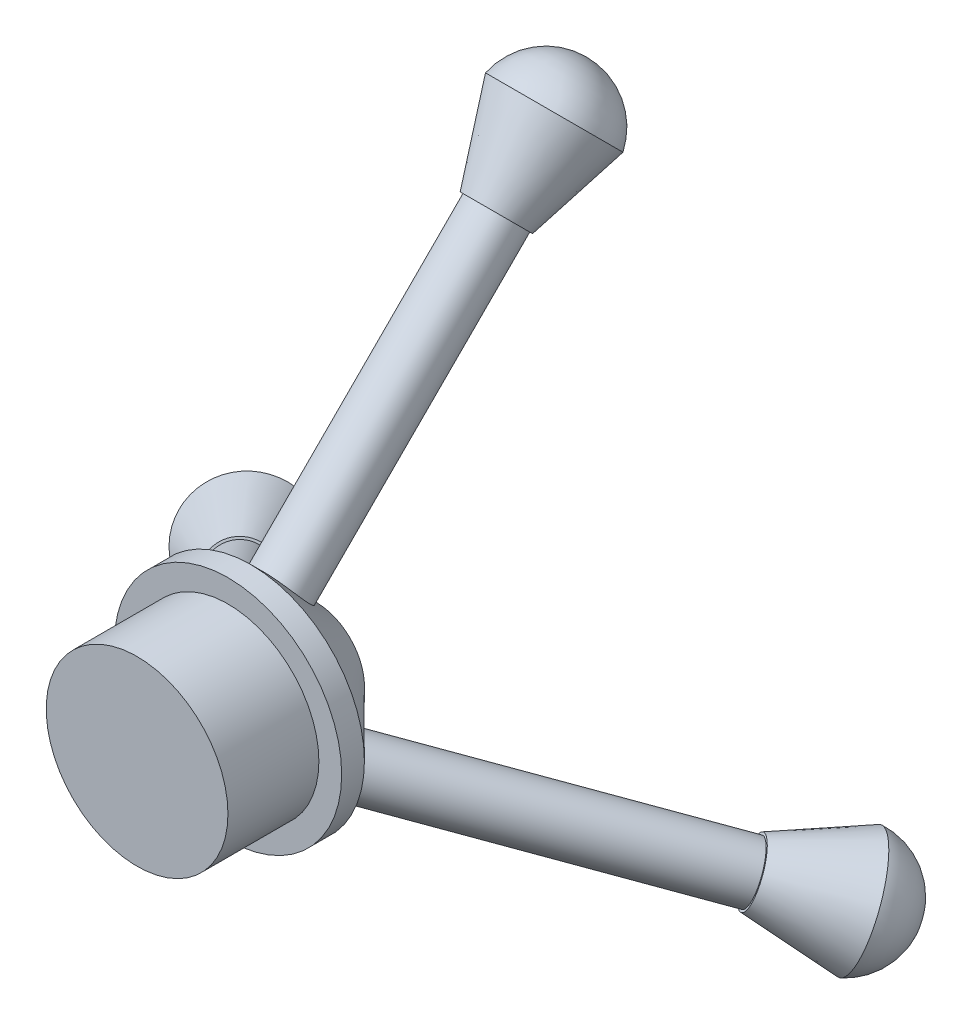
from build123d import *

# Parameters (mm, degrees)
SKETCH1_R                   = 25
BOSS_EXTRUDE1_DEPTH         = 45
CUT_EXTRUDE1_START          = -20
SKETCH2_R                   = 25
SKETCH2_R_2                 = 19.985
CUT_EXTRUDE1_DEPTH          = 20
CHAMFER1_SIZE               = 20
SKETCH3_R                   = 6
BOSS_EXTRUDE2_DEPTH         = 70
CUT_EXTRUDE2_DEPTH          = 70
CUT_EXTRUDE2_DEPTH_BACK     = 70
SKETCH4_W                   = 11.30856595
SKETCH4_H                   = 25.35365412
SKETCH5_R                   = 6.5
BOSS_EXTRUDE3_DEPTH         = 18
BOSS_EXTRUDE3_DRAFT         = -18
CIRPATTERN1_COUNT           = 3
CIRPATTERN1_COPY_1_SKETCH_R = 6.5
CIRPATTERN1_COPY_1_DEPTH    = 18
CIRPATTERN1_COPY_1_DRAFT    = -18
CIRPATTERN1_COPY_2_SKETCH_R = 6.5
CIRPATTERN1_COPY_2_DEPTH    = 18
CIRPATTERN1_COPY_2_DRAFT    = -18


# Read off the part's stored shape, not the designer's step: Dome1
with BuildPart() as part:
    # Sketch1 → Boss-Extrude1 (new body)
    with BuildSketch(Plane.XY):
        with Locations(Location((0, 0, 0), (0, 0, 180))):
            Circle(SKETCH1_R)
    extrude(amount=BOSS_EXTRUDE1_DEPTH)

    # Sketch2 → Cut-Extrude1 (cut)
    with BuildSketch(Plane.XY.offset(45).offset(CUT_EXTRUDE1_START)):
        with Locations(Location((0, 0, 0), (0, 0, 180))):
            Circle(SKETCH2_R)
        Circle(SKETCH2_R_2, mode=Mode.SUBTRACT)
    extrude(amount=CUT_EXTRUDE1_DEPTH, mode=Mode.SUBTRACT)

    # Chamfer1
    chamfer1_edges = [part.edges().sort_by_distance(p)[0] for p in [
        (25, 0, 0),
    ]]
    chamfer(chamfer1_edges, length=CHAMFER1_SIZE)

    # Sketch3 → Boss-Extrude2 (add)
    with BuildSketch(Plane(origin=(0, 0, 0), x_dir=(-1, 0, 0), z_dir=(0, 0.7071067811865475, -0.7071067811865477))):
        with Locations(Location((0, 21.894618235, 0), (0, 0, 291.115116648))):
            Circle(SKETCH3_R)
    boss_extrude2 = extrude(amount=BOSS_EXTRUDE2_DEPTH)

    # Sketch4 → Cut-Extrude2 (cut, two sides: drawn at the far end of the back side and taken through both)
    with BuildSketch(Plane(origin=(0, 0, 0), x_dir=(0, 0, -1), z_dir=(1, 0, 0)).offset(-CUT_EXTRUDE2_DEPTH_BACK)):
        Rectangle(SKETCH4_W, SKETCH4_H)
    extrude(amount=CUT_EXTRUDE2_DEPTH + CUT_EXTRUDE2_DEPTH_BACK, mode=Mode.SUBTRACT)


with BuildPart() as boss_extrude3_tool:
    # Sketch5 → Boss-Extrude3 (with draft: the straight prism first)
    with BuildSketch(Plane(origin=(0, 49.497474683, -49.497474683), x_dir=(1, 0, 0), z_dir=(0, 0.7071067811865476, -0.7071067811865476))):
        with Locations((0, -21.894618235)):
            Circle(SKETCH5_R)
    extrude(amount=BOSS_EXTRUDE3_DEPTH)
    # Boss-Extrude3: the draft: its side faces are tilted about the plane it starts from
    boss_extrude3_sides = [boss_extrude3_tool.faces().sort_by_distance(p)[0] for p in [
        (-6.5, 71.343268739, -40.379602689),
    ]]
    draft(boss_extrude3_sides, Plane(origin=(0, 49.497474683, -49.497474683), x_dir=(1, 0, 0), z_dir=(0, 0.7071067811865476, -0.7071067811865476)), BOSS_EXTRUDE3_DRAFT)


with BuildPart() as part_1:
    add(part.part)

    # Boss-Extrude3: add boss_extrude3_tool
    add(boss_extrude3_tool.part)

    # Dome1 outline → Dome1 (revolve)
    with BuildSketch(Plane(origin=(0, 15.481833025, 15.481833025), x_dir=(1, 0, 0), z_dir=(0, 0.7071067811865476, 0.7071067811865476))):
        with BuildLine():
            Line((0, 88), (12.348554535, 87.999999988))
            ThreePointArc((12.348554535, 87.999999988), (7.944916603, 95.186483631), (0, 98))
            Line((0, 98), (0, 88))
        make_face()
    dome1 = revolve(axis=Axis((0, 15.481833025, 15.481833025), (0, 0.7071067811865476, -0.7071067811865476)))

    # CirPattern1: Boss-Extrude2, Dome1 ×3 about axis
    cirpattern1_axis = Axis((0, 0, 0), (0, 0, 1))
    add([boss_extrude2.rotate(cirpattern1_axis, i * 360 / CIRPATTERN1_COUNT) for i in range(1, CIRPATTERN1_COUNT)])
    add([dome1.rotate(cirpattern1_axis, i * 360 / CIRPATTERN1_COUNT) for i in range(1, CIRPATTERN1_COUNT)])


with BuildPart() as cirpattern1_copy_1_tool:
    # CirPattern1 copy 1 sketch → CirPattern1 copy 1 (with draft: the straight prism first)
    with BuildSketch(Plane(origin=(-42.866070499, -24.748737342, -49.497474683), x_dir=(-0.4999999999999998, 0.8660254037844387, 0), z_dir=(-0.6123724356957946, -0.3535533905932736, -0.7071067811865476))):
        with Locations((0, -21.894618235)):
            Circle(CIRPATTERN1_COPY_1_SKETCH_R)
    extrude(amount=CIRPATTERN1_COPY_1_DEPTH)
    # CirPattern1 copy 1: the draft: its side faces are tilted about the plane it starts from
    cirpattern1_copy_1_sides = [cirpattern1_copy_1_tool.faces().sort_by_distance(p)[0] for p in [
        (-58.535083117, -41.300799494, -40.379602689),
    ]]
    draft(cirpattern1_copy_1_sides, Plane(origin=(-42.866070499, -24.748737342, -49.497474683), x_dir=(-0.4999999999999998, 0.8660254037844387, 0), z_dir=(-0.6123724356957946, -0.3535533905932736, -0.7071067811865476)), CIRPATTERN1_COPY_1_DRAFT)


with BuildPart() as part_2:
    add(part_1.part)

    # CirPattern1 copy 1: add cirpattern1_copy_1_tool
    add(cirpattern1_copy_1_tool.part)


with BuildPart() as cirpattern1_copy_2_tool:
    # CirPattern1 copy 2 sketch → CirPattern1 copy 2 (with draft: the straight prism first)
    with BuildSketch(Plane(origin=(42.866070499, -24.748737342, -49.497474683), x_dir=(-0.5000000000000004, -0.8660254037844384, 0), z_dir=(0.6123724356957944, -0.3535533905932741, -0.7071067811865476))):
        with Locations((0, -21.894618235)):
            Circle(CIRPATTERN1_COPY_2_SKETCH_R)
    extrude(amount=CIRPATTERN1_COPY_2_DEPTH)
    # CirPattern1 copy 2: the draft: its side faces are tilted about the plane it starts from
    cirpattern1_copy_2_sides = [cirpattern1_copy_2_tool.faces().sort_by_distance(p)[0] for p in [
        (65.035083117, -30.042469245, -40.379602689),
    ]]
    draft(cirpattern1_copy_2_sides, Plane(origin=(42.866070499, -24.748737342, -49.497474683), x_dir=(-0.5000000000000004, -0.8660254037844384, 0), z_dir=(0.6123724356957944, -0.3535533905932741, -0.7071067811865476)), CIRPATTERN1_COPY_2_DRAFT)


with BuildPart() as part_3:
    add(part_2.part)

    # CirPattern1 copy 2: add cirpattern1_copy_2_tool
    add(cirpattern1_copy_2_tool.part)


solid = part_3.part
